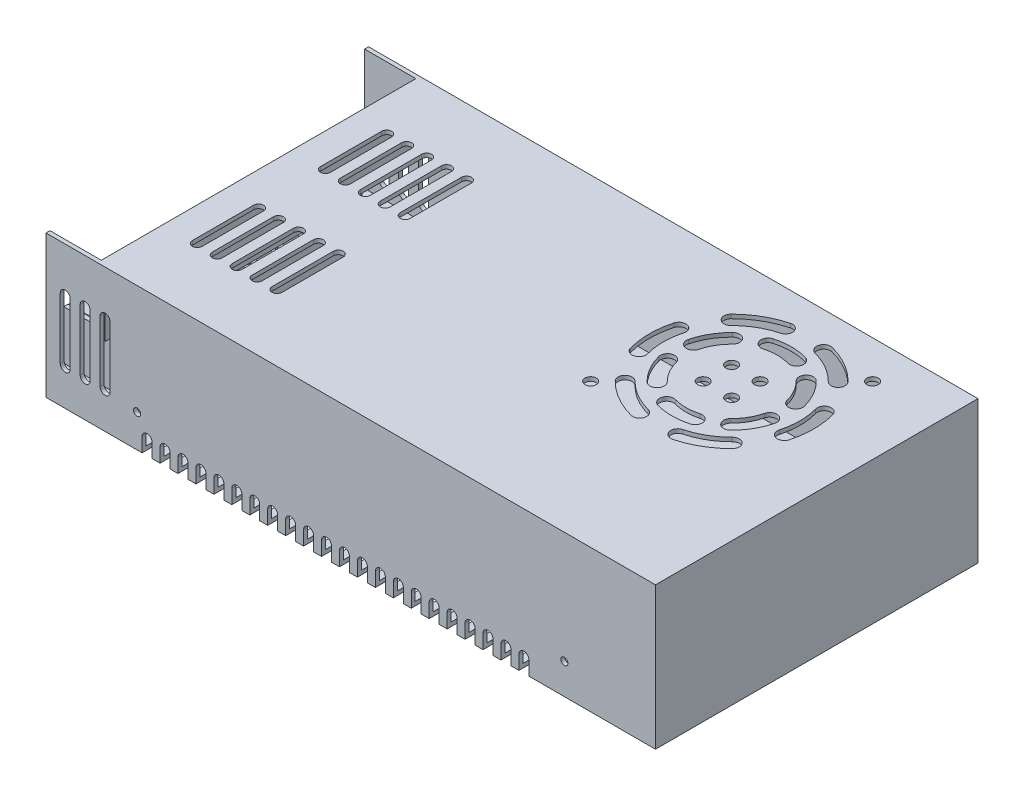
from build123d import *

# Parameters (mm, degrees)
BOSS_EXTRUDE1_DEPTH                  = 50
SKETCH2_W                            = 214
SKETCH2_H                            = 113.25
BOSS_EXTRUDE2_DEPTH                  = 1.4
SKETCH3_W                            = 196
SKETCH3_H                            = 113.25
BOSS_EXTRUDE3_DEPTH                  = 1.4
SKETCH4_W                            = 1.4
SKETCH4_H                            = 110.45
BOSS_EXTRUDE4_DEPTH                  = 24
SKETCH16_W                           = 1.4
SKETCH16_H                           = 110.45
BOSS_EXTRUDE5_DEPTH                  = 6
CUT_EXTRUDE1_DEPTH                   = 1.4
CUT_EXTRUDE2_DEPTH                   = 1.4
CUT_EXTRUDE3_START                   = -1.4
CUT_EXTRUDE3_DEPTH                   = 1.4
CUT_EXTRUDE4_DEPTH                   = 1.4
SKETCH15_R                           = 2
CUT_EXTRUDE5_DEPTH                   = 1.4
SKETCH17_W                           = 212.5
SKETCH17_H                           = 110.25
BOSS_EXTRUDE6_DEPTH                  = 1.6
TAP_START                            = -56.625
TAP_DRILL_FOR_M3X0_5_TAP1_OUTLINE_R  = 1.25
TAP_DRILL_FOR_M3X0_5_TAP1_DEPTH      = 1.4
TAP_START_2                          = 55.225
TAP_DRILL_FOR_M3X0_5_TAP2_OUTLINE_R  = 1.25
TAP_DRILL_FOR_M3X0_5_TAP2_DEPTH      = 1.4
SKETCH20_W                           = 1.25
SKETCH20_H                           = 1.4
TAP_DRILL_FOR_M3X0_5_TAP3_AT_2_COUNT = 2
TAP_DRILL_FOR_M3X0_5_TAP3_AT_2_PITCH = 95
TAP_DRILL_FOR_M3X0_5_TAP3_AT_3_COUNT = 2
TAP_DRILL_FOR_M3X0_5_TAP3_AT_3_PITCH = 177
TAP_DRILL_FOR_M3X0_5_TAP3_AT_4_COUNT = 2
TAP_DRILL_FOR_M3X0_5_TAP3_AT_4_PITCH = 200.883050554
SKETCH21_W                           = 1.65
SKETCH21_H                           = 7.7
TAP_DRILL_FOR_M4X0_7_TAP1_AT_2_COUNT = 2
TAP_DRILL_FOR_M4X0_7_TAP1_AT_2_PITCH = 50
TAP_DRILL_FOR_M4X0_7_TAP1_AT_3_COUNT = 2
TAP_DRILL_FOR_M4X0_7_TAP1_AT_3_PITCH = 150
TAP_DRILL_FOR_M4X0_7_TAP1_AT_4_COUNT = 2
TAP_DRILL_FOR_M4X0_7_TAP1_AT_4_PITCH = 158.113883008
SKETCH22_W                           = 17.5
SKETCH22_H                           = 87.3
BOSS_EXTRUDE7_DEPTH                  = 7
BOSS_EXTRUDE8_DEPTH                  = 13.2
BOSS_EXTRUDE9_DEPTH                  = 17.2
SKETCH23_W                           = 7.633333334
SKETCH23_H                           = 7.633333333
SKETCH23_H_2                         = 7.633333334
BOSS_EXTRUDE10_DEPTH                 = 1.2
SKETCH23_3_R                         = 3.25
BOSS_EXTRUDE11_DEPTH                 = 4
FILLET1_R                            = 1
CUT_EXTRUDE7_START                   = 3
CUT_EXTRUDE7_DEPTH                   = 1
SKETCH24_W                           = 17.3
SKETCH24_H                           = 83.9
BOSS_EXTRUDE12_DEPTH                 = 2
SKETCH25_W                           = 1.9
SKETCH25_H                           = 0.25
SKETCH25_W_2                         = 2.7
SKETCH25_W_3                         = 0.4
SKETCH25_H_2                         = 8.5
BOSS_EXTRUDE13_DEPTH                 = 0.01


# Read off the part's stored shape, not the designer's step: Tap Drill for M3x0.5 Tap1, Tap Drill for M3x0.5 Tap2
with BuildPart() as part:
    # Sketch1 → Boss-Extrude1 (new body)
    with BuildSketch(Plane(origin=(0, 0, 0), x_dir=(1, 0, 0), z_dir=(0, 1, 0))):
        Polygon((-107, 55.225), (105.6, 55.225), (105.6, -55.225), (-107, -55.225), (-107, -56.625), (107, -56.625), (107, 56.625), (-107, 56.625), align=None)
    extrude(amount=BOSS_EXTRUDE1_DEPTH)

    # Sketch2 → Boss-Extrude2 (add)
    with BuildSketch(Plane(origin=(0, 0, 0), x_dir=(1, 0, 0), z_dir=(0, 1, 0))):
        Rectangle(SKETCH2_W, SKETCH2_H)
    extrude(amount=BOSS_EXTRUDE2_DEPTH)

    # Sketch3 → Boss-Extrude3 (add)
    with BuildSketch(Plane(origin=(0, 50, 0), x_dir=(1, 0, 0), z_dir=(0, 1, 0))):
        with Locations((9, 0)):
            Rectangle(SKETCH3_W, SKETCH3_H)
    extrude(amount=-BOSS_EXTRUDE3_DEPTH)

    # Sketch4 → Boss-Extrude4 (add)
    with BuildSketch(Plane(origin=(0, 50, 0), x_dir=(1, 0, 0), z_dir=(0, 1, 0))):
        with Locations((-88.3, 0)):
            Rectangle(SKETCH4_W, SKETCH4_H)
    extrude(amount=-BOSS_EXTRUDE4_DEPTH)

    # Sketch16 → Boss-Extrude5 (add)
    with BuildSketch(Plane.XZ):
        with Locations((-106.3, 0)):
            Rectangle(SKETCH16_W, SKETCH16_H)
    extrude(amount=-BOSS_EXTRUDE5_DEPTH)

    # Sketch5 → Cut-Extrude1 (cut)
    with BuildSketch(Plane(origin=(0, 50, 0), x_dir=(1, 0, 0), z_dir=(0, 1, 0))):
        with BuildLine():
            Line((-79, -11.75), (-79, -33.25))
            ThreePointArc((-79, -33.25), (-77.25, -35), (-75.5, -33.25))
            Line((-75.5, -33.25), (-75.5, -11.75))
            ThreePointArc((-75.5, -11.75), (-77.25, -10), (-79, -11.75))
        make_face()
        with BuildLine():
            Line((-72, -11.75), (-72, -33.25))
            ThreePointArc((-72, -33.25), (-70.25, -35), (-68.5, -33.25))
            Line((-68.5, -33.25), (-68.5, -11.75))
            ThreePointArc((-68.5, -11.75), (-70.25, -10), (-72, -11.75))
        make_face()
        with BuildLine():
            Line((-65, -11.75), (-65, -33.25))
            ThreePointArc((-65, -33.25), (-63.25, -35), (-61.5, -33.25))
            Line((-61.5, -33.25), (-61.5, -11.75))
            ThreePointArc((-61.5, -11.75), (-63.25, -10), (-65, -11.75))
        make_face()
        with BuildLine():
            Line((-58, -11.75), (-58, -33.25))
            ThreePointArc((-58, -33.25), (-56.25, -35), (-54.5, -33.25))
            Line((-54.5, -33.25), (-54.5, -11.75))
            ThreePointArc((-54.5, -11.75), (-56.25, -10), (-58, -11.75))
        make_face()
        with BuildLine():
            Line((-51, -11.75), (-51, -33.25))
            ThreePointArc((-51, -33.25), (-49.25, -35), (-47.5, -33.25))
            Line((-47.5, -33.25), (-47.5, -11.75))
            ThreePointArc((-47.5, -11.75), (-49.25, -10), (-51, -11.75))
        make_face()
        with BuildLine():
            Line((-47.5, 33.25), (-47.5, 11.75))
            ThreePointArc((-47.5, 11.75), (-49.25, 10), (-51, 11.75))
            Line((-51, 11.75), (-51, 33.25))
            ThreePointArc((-51, 33.25), (-49.25, 35), (-47.5, 33.25))
        make_face()
        with BuildLine():
            Line((-54.5, 33.25), (-54.5, 11.75))
            ThreePointArc((-54.5, 11.75), (-56.25, 10), (-58, 11.75))
            Line((-58, 11.75), (-58, 33.25))
            ThreePointArc((-58, 33.25), (-56.25, 35), (-54.5, 33.25))
        make_face()
        with BuildLine():
            Line((-61.5, 33.25), (-61.5, 11.75))
            ThreePointArc((-61.5, 11.75), (-63.25, 10), (-65, 11.75))
            Line((-65, 11.75), (-65, 33.25))
            ThreePointArc((-65, 33.25), (-63.25, 35), (-61.5, 33.25))
        make_face()
        with BuildLine():
            Line((-68.5, 33.25), (-68.5, 11.75))
            ThreePointArc((-68.5, 11.75), (-70.25, 10), (-72, 11.75))
            Line((-72, 11.75), (-72, 33.25))
            ThreePointArc((-72, 33.25), (-70.25, 35), (-68.5, 33.25))
        make_face()
        with BuildLine():
            Line((-75.5, 33.25), (-75.5, 11.75))
            ThreePointArc((-75.5, 11.75), (-77.25, 10), (-79, 11.75))
            Line((-79, 11.75), (-79, 33.25))
            ThreePointArc((-79, 33.25), (-77.25, 35), (-75.5, 33.25))
        make_face()
    extrude(amount=-CUT_EXTRUDE1_DEPTH, mode=Mode.SUBTRACT)

    # Sketch6 → Cut-Extrude2 (cut)
    with BuildSketch(Plane(origin=(0, 0, -56.625), x_dir=(-1, 0, 0), z_dir=(0, 0, -1))):
        with BuildLine():
            Line((102, 34.25), (102, 12.75))
            ThreePointArc((102, 12.75), (100.25, 11), (98.5, 12.75))
            Line((98.5, 12.75), (98.5, 34.25))
            ThreePointArc((98.5, 34.25), (100.25, 36), (102, 34.25))
        make_face()
        with BuildLine():
            Line((91.5, 34.25), (91.5, 12.75))
            ThreePointArc((91.5, 12.75), (93.25, 11), (95, 12.75))
            Line((95, 12.75), (95, 34.25))
            ThreePointArc((95, 34.25), (93.25, 36), (91.5, 34.25))
        make_face()
        with BuildLine():
            Line((84.5, 34.25), (84.5, 12.75))
            ThreePointArc((84.5, 12.75), (86.25, 11), (88, 12.75))
            Line((88, 12.75), (88, 34.25))
            ThreePointArc((88, 34.25), (86.25, 36), (84.5, 34.25))
        make_face()
        with BuildLine():
            Line((73.25, 5), (73.25, 0))
            Line((73.25, 0), (69.75, 0))
            Line((69.75, 0), (69.75, 5))
            ThreePointArc((69.75, 5), (71.5, 6.75), (73.25, 5))
        make_face()
        with BuildLine():
            Line((66.95, 5), (66.95, 0))
            Line((66.95, 0), (63.45, 0))
            Line((63.45, 0), (63.45, 5))
            ThreePointArc((63.45, 5), (65.2, 6.75), (66.95, 5))
        make_face()
        with BuildLine():
            Line((60.65, 5), (60.65, 0))
            Line((60.65, 0), (57.15, 0))
            Line((57.15, 0), (57.15, 5))
            ThreePointArc((57.15, 5), (58.9, 6.75), (60.65, 5))
        make_face()
        with BuildLine():
            Line((54.35, 5), (54.35, 0))
            Line((54.35, 0), (50.85, 0))
            Line((50.85, 0), (50.85, 5))
            ThreePointArc((50.85, 5), (52.6, 6.75), (54.35, 5))
        make_face()
        with BuildLine():
            Line((48.05, 5), (48.05, 0))
            Line((48.05, 0), (44.55, 0))
            Line((44.55, 0), (44.55, 5))
            ThreePointArc((44.55, 5), (46.3, 6.75), (48.05, 5))
        make_face()
        with BuildLine():
            Line((41.75, 5), (41.75, 0))
            Line((41.75, 0), (38.25, 0))
            Line((38.25, 0), (38.25, 5))
            ThreePointArc((38.25, 5), (40, 6.75), (41.75, 5))
        make_face()
        with BuildLine():
            Line((35.45, 5), (35.45, 0))
            Line((35.45, 0), (31.95, 0))
            Line((31.95, 0), (31.95, 5))
            ThreePointArc((31.95, 5), (33.7, 6.75), (35.45, 5))
        make_face()
        with BuildLine():
            Line((29.15, 5), (29.15, 0))
            Line((29.15, 0), (25.65, 0))
            Line((25.65, 0), (25.65, 5))
            ThreePointArc((25.65, 5), (27.4, 6.75), (29.15, 5))
        make_face()
        with BuildLine():
            Line((22.85, 5), (22.85, 0))
            Line((22.85, 0), (19.35, 0))
            Line((19.35, 0), (19.35, 5))
            ThreePointArc((19.35, 5), (21.1, 6.75), (22.85, 5))
        make_face()
        with BuildLine():
            Line((16.55, 5), (16.55, 0))
            Line((16.55, 0), (13.05, 0))
            Line((13.05, 0), (13.05, 5))
            ThreePointArc((13.05, 5), (14.8, 6.75), (16.55, 5))
        make_face()
        with BuildLine():
            Line((10.25, 5), (10.25, 0))
            Line((10.25, 0), (6.75, 0))
            Line((6.75, 0), (6.75, 5))
            ThreePointArc((6.75, 5), (8.5, 6.75), (10.25, 5))
        make_face()
        with BuildLine():
            Line((3.95, 5), (3.95, 0))
            Line((3.95, 0), (0.45, 0))
            Line((0.45, 0), (0.45, 5))
            ThreePointArc((0.45, 5), (2.2, 6.75), (3.95, 5))
        make_face()
        with BuildLine():
            Line((-2.35, 5), (-2.35, 0))
            Line((-2.35, 0), (-5.85, 0))
            Line((-5.85, 0), (-5.85, 5))
            ThreePointArc((-5.85, 5), (-4.1, 6.75), (-2.35, 5))
        make_face()
        with BuildLine():
            Line((-8.65, 5), (-8.65, 0))
            Line((-8.65, 0), (-12.15, 0))
            Line((-12.15, 0), (-12.15, 5))
            ThreePointArc((-12.15, 5), (-10.4, 6.75), (-8.65, 5))
        make_face()
        with BuildLine():
            Line((-14.95, 5), (-14.95, 0))
            Line((-14.95, 0), (-18.45, 0))
            Line((-18.45, 0), (-18.45, 5))
            ThreePointArc((-18.45, 5), (-16.7, 6.75), (-14.95, 5))
        make_face()
        with BuildLine():
            Line((-21.25, 5), (-21.25, 0))
            Line((-21.25, 0), (-24.75, 0))
            Line((-24.75, 0), (-24.75, 5))
            ThreePointArc((-24.75, 5), (-23, 6.75), (-21.25, 5))
        make_face()
        with BuildLine():
            Line((-27.55, 5), (-27.55, 0))
            Line((-27.55, 0), (-31.05, 0))
            Line((-31.05, 0), (-31.05, 5))
            ThreePointArc((-31.05, 5), (-29.3, 6.75), (-27.55, 5))
        make_face()
        with BuildLine():
            Line((-33.85, 5), (-33.85, 0))
            Line((-33.85, 0), (-37.35, 0))
            Line((-37.35, 0), (-37.35, 5))
            ThreePointArc((-37.35, 5), (-35.6, 6.75), (-33.85, 5))
        make_face()
        with BuildLine():
            Line((-40.15, 5), (-40.15, 0))
            Line((-40.15, 0), (-43.65, 0))
            Line((-43.65, 0), (-43.65, 5))
            ThreePointArc((-43.65, 5), (-41.9, 6.75), (-40.15, 5))
        make_face()
        with BuildLine():
            Line((-46.45, 5), (-46.45, 0))
            Line((-46.45, 0), (-49.95, 0))
            Line((-49.95, 0), (-49.95, 5))
            ThreePointArc((-49.95, 5), (-48.2, 6.75), (-46.45, 5))
        make_face()
        with BuildLine():
            Line((-52.75, 5), (-52.75, 0))
            Line((-52.75, 0), (-56.25, 0))
            Line((-56.25, 0), (-56.25, 5))
            ThreePointArc((-56.25, 5), (-54.5, 6.75), (-52.75, 5))
        make_face()
        with BuildLine():
            Line((-59.05, 5), (-59.05, 0))
            Line((-59.05, 0), (-62.55, 0))
            Line((-62.55, 0), (-62.55, 5))
            ThreePointArc((-62.55, 5), (-60.8, 6.75), (-59.05, 5))
        make_face()
    extrude(amount=-CUT_EXTRUDE2_DEPTH, mode=Mode.SUBTRACT)

    # Sketch7 → Cut-Extrude3 (cut)
    with BuildSketch(Plane.XY.offset(56.625).offset(CUT_EXTRUDE3_START)):
        with BuildLine():
            Line((-102, 34.25), (-102, 12.75))
            ThreePointArc((-102, 12.75), (-100.25, 11), (-98.5, 12.75))
            Line((-98.5, 12.75), (-98.5, 34.25))
            ThreePointArc((-98.5, 34.25), (-100.25, 36), (-102, 34.25))
        make_face()
        with BuildLine():
            Line((-73.25, 5), (-73.25, 0))
            Line((-73.25, 0), (-69.75, 0))
            Line((-69.75, 0), (-69.75, 5))
            ThreePointArc((-69.75, 5), (-71.5, 6.75), (-73.25, 5))
        make_face()
        with BuildLine():
            Line((-84.5, 12.75), (-84.5, 34.25))
            ThreePointArc((-84.5, 34.25), (-86.25, 36), (-88, 34.25))
            Line((-88, 34.25), (-88, 12.75))
            ThreePointArc((-88, 12.75), (-86.25, 11), (-84.5, 12.75))
        make_face()
        with BuildLine():
            Line((-91.5, 12.75), (-91.5, 34.25))
            ThreePointArc((-91.5, 34.25), (-93.25, 36), (-95, 34.25))
            Line((-95, 34.25), (-95, 12.75))
            ThreePointArc((-95, 12.75), (-93.25, 11), (-91.5, 12.75))
        make_face()
        with BuildLine():
            Line((-54.35, 5), (-54.35, 0))
            Line((-54.35, 0), (-50.85, 0))
            Line((-50.85, 0), (-50.85, 5))
            ThreePointArc((-50.85, 5), (-52.6, 6.75), (-54.35, 5))
        make_face()
        with BuildLine():
            Line((-60.65, 5), (-60.65, 0))
            Line((-60.65, 0), (-57.15, 0))
            Line((-57.15, 0), (-57.15, 5))
            ThreePointArc((-57.15, 5), (-58.9, 6.75), (-60.65, 5))
        make_face()
        with BuildLine():
            Line((-63.45, 0), (-63.45, 5))
            ThreePointArc((-63.45, 5), (-65.2, 6.75), (-66.95, 5))
            Line((-66.95, 5), (-66.95, 0))
            Line((-66.95, 0), (-63.45, 0))
        make_face()
        with BuildLine():
            Line((-29.15, 5), (-29.15, 0))
            Line((-29.15, 0), (-25.65, 0))
            Line((-25.65, 0), (-25.65, 5))
            ThreePointArc((-25.65, 5), (-27.4, 6.75), (-29.15, 5))
        make_face()
        with BuildLine():
            Line((-35.45, 5), (-35.45, 0))
            Line((-35.45, 0), (-31.95, 0))
            Line((-31.95, 0), (-31.95, 5))
            ThreePointArc((-31.95, 5), (-33.7, 6.75), (-35.45, 5))
        make_face()
        with BuildLine():
            Line((-41.75, 5), (-41.75, 0))
            Line((-41.75, 0), (-38.25, 0))
            Line((-38.25, 0), (-38.25, 5))
            ThreePointArc((-38.25, 5), (-40, 6.75), (-41.75, 5))
        make_face()
        with BuildLine():
            Line((-44.55, 0), (-44.55, 5))
            ThreePointArc((-44.55, 5), (-46.3, 6.75), (-48.05, 5))
            Line((-48.05, 5), (-48.05, 0))
            Line((-48.05, 0), (-44.55, 0))
        make_face()
        with BuildLine():
            Line((-10.25, 5), (-10.25, 0))
            Line((-10.25, 0), (-6.75, 0))
            Line((-6.75, 0), (-6.75, 5))
            ThreePointArc((-6.75, 5), (-8.5, 6.75), (-10.25, 5))
        make_face()
        with BuildLine():
            Line((-16.55, 5), (-16.55, 0))
            Line((-16.55, 0), (-13.05, 0))
            Line((-13.05, 0), (-13.05, 5))
            ThreePointArc((-13.05, 5), (-14.8, 6.75), (-16.55, 5))
        make_face()
        with BuildLine():
            Line((-22.85, 5), (-22.85, 0))
            Line((-22.85, 0), (-19.35, 0))
            Line((-19.35, 0), (-19.35, 5))
            ThreePointArc((-19.35, 5), (-21.1, 6.75), (-22.85, 5))
        make_face()
        with BuildLine():
            Line((8.65, 5), (8.65, 0))
            Line((8.65, 0), (12.15, 0))
            Line((12.15, 0), (12.15, 5))
            ThreePointArc((12.15, 5), (10.4, 6.75), (8.65, 5))
        make_face()
        with BuildLine():
            Line((2.35, 5), (2.35, 0))
            Line((2.35, 0), (5.85, 0))
            Line((5.85, 0), (5.85, 5))
            ThreePointArc((5.85, 5), (4.1, 6.75), (2.35, 5))
        make_face()
        with BuildLine():
            Line((-3.95, 5), (-3.95, 0))
            Line((-3.95, 0), (-0.45, 0))
            Line((-0.45, 0), (-0.45, 5))
            ThreePointArc((-0.45, 5), (-2.2, 6.75), (-3.95, 5))
        make_face()
        with BuildLine():
            Line((27.55, 5), (27.55, 0))
            Line((27.55, 0), (31.05, 0))
            Line((31.05, 0), (31.05, 5))
            ThreePointArc((31.05, 5), (29.3, 6.75), (27.55, 5))
        make_face()
        with BuildLine():
            Line((21.25, 5), (21.25, 0))
            Line((21.25, 0), (24.75, 0))
            Line((24.75, 0), (24.75, 5))
            ThreePointArc((24.75, 5), (23, 6.75), (21.25, 5))
        make_face()
        with BuildLine():
            Line((14.95, 5), (14.95, 0))
            Line((14.95, 0), (18.45, 0))
            Line((18.45, 0), (18.45, 5))
            ThreePointArc((18.45, 5), (16.7, 6.75), (14.95, 5))
        make_face()
        with BuildLine():
            Line((46.45, 5), (46.45, 0))
            Line((46.45, 0), (49.95, 0))
            Line((49.95, 0), (49.95, 5))
            ThreePointArc((49.95, 5), (48.2, 6.75), (46.45, 5))
        make_face()
        with BuildLine():
            Line((40.15, 5), (40.15, 0))
            Line((40.15, 0), (43.65, 0))
            Line((43.65, 0), (43.65, 5))
            ThreePointArc((43.65, 5), (41.9, 6.75), (40.15, 5))
        make_face()
        with BuildLine():
            Line((37.35, 0), (37.35, 5))
            ThreePointArc((37.35, 5), (35.6, 6.75), (33.85, 5))
            Line((33.85, 5), (33.85, 0))
            Line((33.85, 0), (37.35, 0))
        make_face()
        with BuildLine():
            Line((59.05, 5), (59.05, 0))
            Line((59.05, 0), (62.55, 0))
            Line((62.55, 0), (62.55, 5))
            ThreePointArc((62.55, 5), (60.8, 6.75), (59.05, 5))
        make_face()
        with BuildLine():
            Line((56.25, 0), (56.25, 5))
            ThreePointArc((56.25, 5), (54.5, 6.75), (52.75, 5))
            Line((52.75, 5), (52.75, 0))
            Line((52.75, 0), (56.25, 0))
        make_face()
    extrude(amount=CUT_EXTRUDE3_DEPTH, mode=Mode.SUBTRACT)

    # Sketch14 → Cut-Extrude4 (cut)
    with BuildSketch(Plane.XZ):
        with BuildLine():
            Line((-73.25, -55.225), (-73.25, -36.975))
            ThreePointArc((-73.25, -36.975), (-71.5, -35.225), (-69.75, -36.975))
            Line((-69.75, -36.975), (-69.75, -55.225))
            Line((-69.75, -55.225), (-73.25, -55.225))
        make_face()
        with BuildLine():
            Line((-66.95, -55.225), (-66.95, -36.975))
            ThreePointArc((-66.95, -36.975), (-65.2, -35.225), (-63.45, -36.975))
            Line((-63.45, -36.975), (-63.45, -55.225))
            Line((-63.45, -55.225), (-66.95, -55.225))
        make_face()
        with BuildLine():
            Line((-60.65, -55.225), (-60.65, -36.975))
            ThreePointArc((-60.65, -36.975), (-58.9, -35.225), (-57.15, -36.975))
            Line((-57.15, -36.975), (-57.15, -55.225))
            Line((-57.15, -55.225), (-60.65, -55.225))
        make_face()
        with BuildLine():
            Line((-54.35, -55.225), (-54.35, -36.975))
            ThreePointArc((-54.35, -36.975), (-52.6, -35.225), (-50.85, -36.975))
            Line((-50.85, -36.975), (-50.85, -55.225))
            Line((-50.85, -55.225), (-54.35, -55.225))
        make_face()
        with BuildLine():
            Line((-48.05, -55.225), (-48.05, -36.975))
            ThreePointArc((-48.05, -36.975), (-46.3, -35.225), (-44.55, -36.975))
            Line((-44.55, -36.975), (-44.55, -55.225))
            Line((-44.55, -55.225), (-48.05, -55.225))
        make_face()
        with BuildLine():
            Line((-41.75, -55.225), (-41.75, -36.975))
            ThreePointArc((-41.75, -36.975), (-40, -35.225), (-38.25, -36.975))
            Line((-38.25, -36.975), (-38.25, -55.225))
            Line((-38.25, -55.225), (-41.75, -55.225))
        make_face()
        with BuildLine():
            Line((-35.45, -55.225), (-35.45, -36.975))
            ThreePointArc((-35.45, -36.975), (-33.7, -35.225), (-31.95, -36.975))
            Line((-31.95, -36.975), (-31.95, -55.225))
            Line((-31.95, -55.225), (-35.45, -55.225))
        make_face()
        with BuildLine():
            Line((-29.15, -55.225), (-29.15, -36.975))
            ThreePointArc((-29.15, -36.975), (-27.4, -35.225), (-25.65, -36.975))
            Line((-25.65, -36.975), (-25.65, -55.225))
            Line((-25.65, -55.225), (-29.15, -55.225))
        make_face()
        with BuildLine():
            Line((-22.85, -55.225), (-22.85, -36.975))
            ThreePointArc((-22.85, -36.975), (-21.1, -35.225), (-19.35, -36.975))
            Line((-19.35, -36.975), (-19.35, -55.225))
            Line((-19.35, -55.225), (-22.85, -55.225))
        make_face()
        with BuildLine():
            Line((-16.55, -55.225), (-16.55, -36.975))
            ThreePointArc((-16.55, -36.975), (-14.8, -35.225), (-13.05, -36.975))
            Line((-13.05, -36.975), (-13.05, -55.225))
            Line((-13.05, -55.225), (-16.55, -55.225))
        make_face()
        with BuildLine():
            Line((-10.25, -55.225), (-10.25, -36.975))
            ThreePointArc((-10.25, -36.975), (-8.5, -35.225), (-6.75, -36.975))
            Line((-6.75, -36.975), (-6.75, -55.225))
            Line((-6.75, -55.225), (-10.25, -55.225))
        make_face()
        with BuildLine():
            Line((-3.95, -55.225), (-3.95, -36.975))
            ThreePointArc((-3.95, -36.975), (-2.2, -35.225), (-0.45, -36.975))
            Line((-0.45, -36.975), (-0.45, -55.225))
            Line((-0.45, -55.225), (-3.95, -55.225))
        make_face()
        with BuildLine():
            Line((2.35, -55.225), (2.35, -36.975))
            ThreePointArc((2.35, -36.975), (4.1, -35.225), (5.85, -36.975))
            Line((5.85, -36.975), (5.85, -55.225))
            Line((5.85, -55.225), (2.35, -55.225))
        make_face()
        with BuildLine():
            Line((8.65, -55.225), (8.65, -36.975))
            ThreePointArc((8.65, -36.975), (10.4, -35.225), (12.15, -36.975))
            Line((12.15, -36.975), (12.15, -55.225))
            Line((12.15, -55.225), (8.65, -55.225))
        make_face()
        with BuildLine():
            Line((14.95, -55.225), (14.95, -36.975))
            ThreePointArc((14.95, -36.975), (16.7, -35.225), (18.45, -36.975))
            Line((18.45, -36.975), (18.45, -55.225))
            Line((18.45, -55.225), (14.95, -55.225))
        make_face()
        with BuildLine():
            Line((21.25, -55.225), (21.25, -36.975))
            ThreePointArc((21.25, -36.975), (23, -35.225), (24.75, -36.975))
            Line((24.75, -36.975), (24.75, -55.225))
            Line((24.75, -55.225), (21.25, -55.225))
        make_face()
        with BuildLine():
            Line((27.55, -55.225), (27.55, -36.975))
            ThreePointArc((27.55, -36.975), (29.3, -35.225), (31.05, -36.975))
            Line((31.05, -36.975), (31.05, -55.225))
            Line((31.05, -55.225), (27.55, -55.225))
        make_face()
        with BuildLine():
            Line((33.85, -55.225), (33.85, -36.975))
            ThreePointArc((33.85, -36.975), (35.6, -35.225), (37.35, -36.975))
            Line((37.35, -36.975), (37.35, -55.225))
            Line((37.35, -55.225), (33.85, -55.225))
        make_face()
        with BuildLine():
            Line((40.15, -55.225), (40.15, -36.975))
            ThreePointArc((40.15, -36.975), (41.9, -35.225), (43.65, -36.975))
            Line((43.65, -36.975), (43.65, -55.225))
            Line((43.65, -55.225), (40.15, -55.225))
        make_face()
        with BuildLine():
            Line((46.45, -55.225), (46.45, -36.975))
            ThreePointArc((46.45, -36.975), (48.2, -35.225), (49.95, -36.975))
            Line((49.95, -36.975), (49.95, -55.225))
            Line((49.95, -55.225), (46.45, -55.225))
        make_face()
        with BuildLine():
            Line((52.75, -55.225), (52.75, -36.975))
            ThreePointArc((52.75, -36.975), (54.5, -35.225), (56.25, -36.975))
            Line((56.25, -36.975), (56.25, -55.225))
            Line((56.25, -55.225), (52.75, -55.225))
        make_face()
        with BuildLine():
            Line((59.05, -55.225), (59.05, -36.975))
            ThreePointArc((59.05, -36.975), (60.8, -35.225), (62.55, -36.975))
            Line((62.55, -36.975), (62.55, -55.225))
            Line((62.55, -55.225), (59.05, -55.225))
        make_face()
        with BuildLine():
            Line((59.05, 55.225), (62.55, 55.225))
            Line((62.55, 55.225), (62.55, 36.975))
            ThreePointArc((62.55, 36.975), (60.8, 35.225), (59.05, 36.975))
            Line((59.05, 36.975), (59.05, 55.225))
        make_face()
        with BuildLine():
            Line((52.75, 55.225), (56.25, 55.225))
            Line((56.25, 55.225), (56.25, 36.975))
            ThreePointArc((56.25, 36.975), (54.5, 35.225), (52.75, 36.975))
            Line((52.75, 36.975), (52.75, 55.225))
        make_face()
        with BuildLine():
            Line((46.45, 55.225), (49.95, 55.225))
            Line((49.95, 55.225), (49.95, 36.975))
            ThreePointArc((49.95, 36.975), (48.2, 35.225), (46.45, 36.975))
            Line((46.45, 36.975), (46.45, 55.225))
        make_face()
        with BuildLine():
            Line((40.15, 55.225), (43.65, 55.225))
            Line((43.65, 55.225), (43.65, 36.975))
            ThreePointArc((43.65, 36.975), (41.9, 35.225), (40.15, 36.975))
            Line((40.15, 36.975), (40.15, 55.225))
        make_face()
        with BuildLine():
            Line((33.85, 55.225), (37.35, 55.225))
            Line((37.35, 55.225), (37.35, 36.975))
            ThreePointArc((37.35, 36.975), (35.6, 35.225), (33.85, 36.975))
            Line((33.85, 36.975), (33.85, 55.225))
        make_face()
        with BuildLine():
            Line((27.55, 55.225), (31.05, 55.225))
            Line((31.05, 55.225), (31.05, 36.975))
            ThreePointArc((31.05, 36.975), (29.3, 35.225), (27.55, 36.975))
            Line((27.55, 36.975), (27.55, 55.225))
        make_face()
        with BuildLine():
            Line((21.25, 55.225), (24.75, 55.225))
            Line((24.75, 55.225), (24.75, 36.975))
            ThreePointArc((24.75, 36.975), (23, 35.225), (21.25, 36.975))
            Line((21.25, 36.975), (21.25, 55.225))
        make_face()
        with BuildLine():
            Line((14.95, 55.225), (18.45, 55.225))
            Line((18.45, 55.225), (18.45, 36.975))
            ThreePointArc((18.45, 36.975), (16.7, 35.225), (14.95, 36.975))
            Line((14.95, 36.975), (14.95, 55.225))
        make_face()
        with BuildLine():
            Line((8.65, 55.225), (12.15, 55.225))
            Line((12.15, 55.225), (12.15, 36.975))
            ThreePointArc((12.15, 36.975), (10.4, 35.225), (8.65, 36.975))
            Line((8.65, 36.975), (8.65, 55.225))
        make_face()
        with BuildLine():
            Line((2.35, 55.225), (5.85, 55.225))
            Line((5.85, 55.225), (5.85, 36.975))
            ThreePointArc((5.85, 36.975), (4.1, 35.225), (2.35, 36.975))
            Line((2.35, 36.975), (2.35, 55.225))
        make_face()
        with BuildLine():
            Line((-3.95, 55.225), (-0.45, 55.225))
            Line((-0.45, 55.225), (-0.45, 36.975))
            ThreePointArc((-0.45, 36.975), (-2.2, 35.225), (-3.95, 36.975))
            Line((-3.95, 36.975), (-3.95, 55.225))
        make_face()
        with BuildLine():
            Line((-10.25, 55.225), (-6.75, 55.225))
            Line((-6.75, 55.225), (-6.75, 36.975))
            ThreePointArc((-6.75, 36.975), (-8.5, 35.225), (-10.25, 36.975))
            Line((-10.25, 36.975), (-10.25, 55.225))
        make_face()
        with BuildLine():
            Line((-16.55, 55.225), (-13.05, 55.225))
            Line((-13.05, 55.225), (-13.05, 36.975))
            ThreePointArc((-13.05, 36.975), (-14.8, 35.225), (-16.55, 36.975))
            Line((-16.55, 36.975), (-16.55, 55.225))
        make_face()
        with BuildLine():
            Line((-22.85, 55.225), (-19.35, 55.225))
            Line((-19.35, 55.225), (-19.35, 36.975))
            ThreePointArc((-19.35, 36.975), (-21.1, 35.225), (-22.85, 36.975))
            Line((-22.85, 36.975), (-22.85, 55.225))
        make_face()
        with BuildLine():
            Line((-29.15, 55.225), (-25.65, 55.225))
            Line((-25.65, 55.225), (-25.65, 36.975))
            ThreePointArc((-25.65, 36.975), (-27.4, 35.225), (-29.15, 36.975))
            Line((-29.15, 36.975), (-29.15, 55.225))
        make_face()
        with BuildLine():
            Line((-35.45, 55.225), (-31.95, 55.225))
            Line((-31.95, 55.225), (-31.95, 36.975))
            ThreePointArc((-31.95, 36.975), (-33.7, 35.225), (-35.45, 36.975))
            Line((-35.45, 36.975), (-35.45, 55.225))
        make_face()
        with BuildLine():
            Line((-41.75, 55.225), (-38.25, 55.225))
            Line((-38.25, 55.225), (-38.25, 36.975))
            ThreePointArc((-38.25, 36.975), (-40, 35.225), (-41.75, 36.975))
            Line((-41.75, 36.975), (-41.75, 55.225))
        make_face()
        with BuildLine():
            Line((-48.05, 55.225), (-44.55, 55.225))
            Line((-44.55, 55.225), (-44.55, 36.975))
            ThreePointArc((-44.55, 36.975), (-46.3, 35.225), (-48.05, 36.975))
            Line((-48.05, 36.975), (-48.05, 55.225))
        make_face()
        with BuildLine():
            Line((-54.35, 55.225), (-50.85, 55.225))
            Line((-50.85, 55.225), (-50.85, 36.975))
            ThreePointArc((-50.85, 36.975), (-52.6, 35.225), (-54.35, 36.975))
            Line((-54.35, 36.975), (-54.35, 55.225))
        make_face()
        with BuildLine():
            Line((-60.65, 55.225), (-57.15, 55.225))
            Line((-57.15, 55.225), (-57.15, 36.975))
            ThreePointArc((-57.15, 36.975), (-58.9, 35.225), (-60.65, 36.975))
            Line((-60.65, 36.975), (-60.65, 55.225))
        make_face()
        with BuildLine():
            Line((-66.95, 55.225), (-63.45, 55.225))
            Line((-63.45, 55.225), (-63.45, 36.975))
            ThreePointArc((-63.45, 36.975), (-65.2, 35.225), (-66.95, 36.975))
            Line((-66.95, 36.975), (-66.95, 55.225))
        make_face()
        with BuildLine():
            Line((-69.75, 36.975), (-69.75, 55.225))
            Line((-69.75, 55.225), (-73.25, 55.225))
            Line((-73.25, 55.225), (-73.25, 36.975))
            ThreePointArc((-73.25, 36.975), (-71.5, 35.225), (-69.75, 36.975))
        make_face()
    extrude(amount=-CUT_EXTRUDE4_DEPTH, mode=Mode.SUBTRACT)

    # Sketch15 → Cut-Extrude5 (cut)
    with BuildSketch(Plane(origin=(0, 50, 0), x_dir=(1, 0, 0), z_dir=(0, 1, 0))):
        with Locations(Location((63.5, 13.625, 0), (0, 0, 270))):
            Circle(SKETCH15_R)
        with Locations(Location((53.5, 13.625, 0), (0, 0, 270))):
            Circle(SKETCH15_R)
        with Locations(Location((53.5, 23.625, 0), (0, 0, 270))):
            Circle(SKETCH15_R)
        with Locations(Location((63.5, 23.625, 0), (0, 0, 270))):
            Circle(SKETCH15_R)
        with Locations(Location((83.248737342, 43.373737342, 0), (0, 0, 270))):
            Circle(SKETCH15_R)
        with Locations(Location((33.751262658, -6.123737342, 0), (0, 0, 270))):
            Circle(SKETCH15_R)
        with BuildLine():
            ThreePointArc((86.384615135, 10.974806293), (87.415, 18.625), (86.384615135, 26.275193707))
            ThreePointArc((86.384615135, 26.275193707), (83.364494342, 27.994927086), (81.644760963, 24.974806293))
            ThreePointArc((81.644760963, 24.974806293), (82.5, 18.625), (81.644760963, 12.275193707))
            ThreePointArc((81.644760963, 12.275193707), (83.364494342, 9.255072914), (86.384615135, 10.974806293))
        make_face()
        with BuildLine():
            ThreePointArc((64.175675676, 38.843474364), (58.5, 39.625), (52.824324324, 38.843474364))
            ThreePointArc((52.824324324, 38.843474364), (51.093038766, 35.760837455), (54.175675676, 34.029551897))
            ThreePointArc((54.175675676, 34.029551897), (58.5, 34.625), (62.824324324, 34.029551897))
            ThreePointArc((62.824324324, 34.029551897), (65.906961234, 35.760837455), (64.175675676, 38.843474364))
        make_face()
        with BuildLine():
            ThreePointArc((64.573286923, -4.593854105), (62.817652283, -7.593247296), (65.817045474, -9.348881935))
            ThreePointArc((65.817045474, -9.348881935), (72.9575, -6.41612455), (79.067569662, -1.698688229))
            ThreePointArc((79.067569662, -1.698688229), (79.046842059, 1.77667979), (75.571474041, 1.755952188))
            ThreePointArc((75.571474041, 1.755952188), (70.5, -2.159609691), (64.573286923, -4.593854105))
        make_face()
        with BuildLine():
            ThreePointArc((41.428525959, 1.755952188), (37.953157941, 1.77667979), (37.932430338, -1.698688229))
            ThreePointArc((37.932430338, -1.698688229), (44.0425, -6.41612455), (51.182954526, -9.348881935))
            ThreePointArc((51.182954526, -9.348881935), (54.182347717, -7.593247296), (52.426713077, -4.593854105))
            ThreePointArc((52.426713077, -4.593854105), (46.5, -2.159609691), (41.428525959, 1.755952188))
        make_face()
        with BuildLine():
            ThreePointArc((35.355239037, 24.974806293), (33.635505658, 27.994927086), (30.615384865, 26.275193707))
            ThreePointArc((30.615384865, 26.275193707), (29.585, 18.625), (30.615384865, 10.974806293))
            ThreePointArc((30.615384865, 10.974806293), (33.635505658, 9.255072914), (35.355239037, 12.275193707))
            ThreePointArc((35.355239037, 12.275193707), (34.5, 18.625), (35.355239037, 24.974806293))
        make_face()
        with BuildLine():
            ThreePointArc((52.426713077, 41.843854105), (54.182347717, 44.843247296), (51.182954526, 46.598881935))
            ThreePointArc((51.182954526, 46.598881935), (44.0425, 43.66612455), (37.932430338, 38.948688229))
            ThreePointArc((37.932430338, 38.948688229), (37.953157941, 35.47332021), (41.428525959, 35.494047812))
            ThreePointArc((41.428525959, 35.494047812), (46.5, 39.409609691), (52.426713077, 41.843854105))
        make_face()
        with BuildLine():
            ThreePointArc((75.571474041, 35.494047812), (79.046842059, 35.47332021), (79.067569662, 38.948688229))
            ThreePointArc((79.067569662, 38.948688229), (72.9575, 43.66612455), (65.817045474, 46.598881935))
            ThreePointArc((65.817045474, 46.598881935), (62.817652283, 44.843247296), (64.573286923, 41.843854105))
            ThreePointArc((64.573286923, 41.843854105), (70.5, 39.409609691), (75.571474041, 35.494047812))
        make_face()
        with BuildLine():
            ThreePointArc((69.678571114, 30.072250667), (69.636589934, 33.607535321), (73.171874588, 33.649516501))
            ThreePointArc((73.171874588, 33.649516501), (76.686533479, 29.125), (78.847550263, 23.818957863))
            ThreePointArc((78.847550263, 23.818957863), (77.043551168, 20.778302134), (74.002895439, 22.582301229))
            ThreePointArc((74.002895439, 22.582301229), (72.356406461, 26.625), (69.678571114, 30.072250667))
        make_face()
        with BuildLine():
            ThreePointArc((74.002895439, 14.667698771), (77.043551168, 16.471697866), (78.847550263, 13.431042137))
            ThreePointArc((78.847550263, 13.431042137), (76.686533479, 8.125), (73.171874588, 3.600483499))
            ThreePointArc((73.171874588, 3.600483499), (69.636589934, 3.642464679), (69.678571114, 7.177749333))
            ThreePointArc((69.678571114, 7.177749333), (72.356406461, 10.625), (74.002895439, 14.667698771))
        make_face()
        with BuildLine():
            ThreePointArc((62.824324324, 3.220448103), (65.906961234, 1.489162545), (64.175675676, -1.593474364))
            ThreePointArc((64.175675676, -1.593474364), (58.5, -2.375), (52.824324324, -1.593474364))
            ThreePointArc((52.824324324, -1.593474364), (51.093038766, 1.489162545), (54.175675676, 3.220448103))
            ThreePointArc((54.175675676, 3.220448103), (58.5, 2.625), (62.824324324, 3.220448103))
        make_face()
        with BuildLine():
            ThreePointArc((47.321428886, 7.177749333), (47.363410066, 3.642464679), (43.828125412, 3.600483499))
            ThreePointArc((43.828125412, 3.600483499), (40.313466521, 8.125), (38.152449737, 13.431042137))
            ThreePointArc((38.152449737, 13.431042137), (39.956448832, 16.471697866), (42.997104561, 14.667698771))
            ThreePointArc((42.997104561, 14.667698771), (44.643593539, 10.625), (47.321428886, 7.177749333))
        make_face()
        with BuildLine():
            ThreePointArc((42.997104561, 22.582301229), (39.956448832, 20.778302134), (38.152449737, 23.818957863))
            ThreePointArc((38.152449737, 23.818957863), (40.313466521, 29.125), (43.828125412, 33.649516501))
            ThreePointArc((43.828125412, 33.649516501), (47.363410066, 33.607535321), (47.321428886, 30.072250667))
            ThreePointArc((47.321428886, 30.072250667), (44.643593539, 26.625), (42.997104561, 22.582301229))
        make_face()
    extrude(amount=-CUT_EXTRUDE5_DEPTH, mode=Mode.SUBTRACT)

    # Tap Drill for M3x0.5 Tap1 outline → Tap Drill for M3x0.5 Tap1 (cut)
    with BuildSketch(Plane.XY.offset(TAP_START)):
        with Locations((-75, 11.5)):
            Circle(TAP_DRILL_FOR_M3X0_5_TAP1_OUTLINE_R)
        with Locations((75, 10.75)):
            Circle(TAP_DRILL_FOR_M3X0_5_TAP1_OUTLINE_R)
    extrude(amount=TAP_DRILL_FOR_M3X0_5_TAP1_DEPTH, mode=Mode.SUBTRACT)

    # Tap Drill for M3x0.5 Tap2 outline → Tap Drill for M3x0.5 Tap2 (cut)
    with BuildSketch(Plane.XY.offset(TAP_START_2)):
        with Locations((-75, 11.5)):
            Circle(TAP_DRILL_FOR_M3X0_5_TAP2_OUTLINE_R)
        with Locations((75, 10.75)):
            Circle(TAP_DRILL_FOR_M3X0_5_TAP2_OUTLINE_R)
    extrude(amount=TAP_DRILL_FOR_M3X0_5_TAP2_DEPTH, mode=Mode.SUBTRACT)

    # Sketch20 → Tap Drill for M3x0.5 Tap3 (revolve, cut)
    with BuildSketch(Plane(origin=(97, 0, 47.5), x_dir=(0, 0, -1), z_dir=(1, 0, 0))):
        with Locations((0.625, 0.7)):
            Rectangle(SKETCH20_W, SKETCH20_H)
    tap_drill_for_m3x0_5_tap3 = revolve(axis=Axis((97, -6.35, 47.5), (0, 1, 0)), mode=Mode.SUBTRACT)

    # Tap Drill for M3x0.5 Tap3 at 2: Tap Drill for M3x0.5 Tap3 ×2
    with Locations(*[(0, 0, -i * TAP_DRILL_FOR_M3X0_5_TAP3_AT_2_PITCH) for i in range(1, TAP_DRILL_FOR_M3X0_5_TAP3_AT_2_COUNT)]):
        add(tap_drill_for_m3x0_5_tap3, mode=Mode.SUBTRACT)

    # Tap Drill for M3x0.5 Tap3 at 3: Tap Drill for M3x0.5 Tap3 ×2
    with Locations(*[(-i * TAP_DRILL_FOR_M3X0_5_TAP3_AT_3_PITCH, 0, 0) for i in range(1, TAP_DRILL_FOR_M3X0_5_TAP3_AT_3_COUNT)]):
        add(tap_drill_for_m3x0_5_tap3, mode=Mode.SUBTRACT)

    # Tap Drill for M3x0.5 Tap3 at 4: Tap Drill for M3x0.5 Tap3 ×2
    with Locations(*[Vector(-0.8811096780520014, 0, -0.47291197409570696) * (i * TAP_DRILL_FOR_M3X0_5_TAP3_AT_4_PITCH) for i in range(1, TAP_DRILL_FOR_M3X0_5_TAP3_AT_4_COUNT)]):
        add(tap_drill_for_m3x0_5_tap3, mode=Mode.SUBTRACT)

    # Sketch21 → Tap Drill for M4x0.7 Tap1 (revolve, cut)
    with BuildSketch(Plane(origin=(75, 0, 25), x_dir=(0, 0, -1), z_dir=(1, 0, 0))):
        with Locations((0.825, 3.85)):
            Rectangle(SKETCH21_W, SKETCH21_H)
    tap_drill_for_m4x0_7_tap1 = revolve(axis=Axis((75, -6.35, 25), (0, 1, 0)), mode=Mode.SUBTRACT)

    # Tap Drill for M4x0.7 Tap1 at 2: Tap Drill for M4x0.7 Tap1 ×2
    with Locations(*[(0, 0, -i * TAP_DRILL_FOR_M4X0_7_TAP1_AT_2_PITCH) for i in range(1, TAP_DRILL_FOR_M4X0_7_TAP1_AT_2_COUNT)]):
        add(tap_drill_for_m4x0_7_tap1, mode=Mode.SUBTRACT)

    # Tap Drill for M4x0.7 Tap1 at 3: Tap Drill for M4x0.7 Tap1 ×2
    with Locations(*[(-i * TAP_DRILL_FOR_M4X0_7_TAP1_AT_3_PITCH, 0, 0) for i in range(1, TAP_DRILL_FOR_M4X0_7_TAP1_AT_3_COUNT)]):
        add(tap_drill_for_m4x0_7_tap1, mode=Mode.SUBTRACT)

    # Tap Drill for M4x0.7 Tap1 at 4: Tap Drill for M4x0.7 Tap1 ×2
    with Locations(*[Vector(-0.9486832980505139, 0, -0.31622776601683794) * (i * TAP_DRILL_FOR_M4X0_7_TAP1_AT_4_PITCH) for i in range(1, TAP_DRILL_FOR_M4X0_7_TAP1_AT_4_COUNT)]):
        add(tap_drill_for_m4x0_7_tap1, mode=Mode.SUBTRACT)

    # Sketch25 → Boss-Extrude13 (add)
    with BuildSketch(Plane.ZY.offset(89)):
        Polygon((44.283333333, 40), (44.283333333, 35.1), (46.933333333, 35.1), (46.933333333, 34.5), (43.683333333, 34.5), (43.683333333, 40), align=None)
        Polygon((34.15, 34.5), (34.15, 40), (34.75, 40), (36.8, 35.853759357), (36.8, 40), (37.4, 40), (37.4, 34.5), (36.8, 34.5), (34.75, 38.646240643), (34.75, 34.5), align=None)
        with Locations((26.241666667, 35.75)):
            Rectangle(SKETCH25_W, SKETCH25_H)
        with Locations((26.241666667, 37)):
            Rectangle(SKETCH25_W_2, SKETCH25_H)
        Polygon((24.491666667, 38.125), (27.991666667, 38.125), (27.991666667, 38.375), (26.366666667, 38.375), (26.366666667, 38.875), (26.116666667, 38.875), (26.116666667, 38.375), (24.491666667, 38.375), align=None)
        with Locations((31.008333333, 37.25)):
            Rectangle(SKETCH25_W_3, SKETCH25_H_2)
        with Locations((40.541666667, 37.25)):
            Rectangle(SKETCH25_W_3, SKETCH25_H_2)
        with Locations((21.475, 37.25)):
            Rectangle(SKETCH25_W_3, SKETCH25_H_2)
        with Locations((-7.125, 37.25)):
            Rectangle(SKETCH25_W_3, SKETCH25_H_2)
    extrude(amount=BOSS_EXTRUDE13_DEPTH)


with BuildPart() as body_2:
    # Sketch17 → Boss-Extrude6 (new body)
    with BuildSketch(Plane(origin=(0, 6.1, 0), x_dir=(1, 0, 0), z_dir=(0, 1, 0))):
        with Locations((-0.75, 0)):
            Rectangle(SKETCH17_W, SKETCH17_H)
    extrude(amount=BOSS_EXTRUDE6_DEPTH)

    # Sketch22 → Boss-Extrude7 (add)
    with BuildSketch(Plane(origin=(0, 7.7, 0), x_dir=(1, 0, 0), z_dir=(0, 1, 0))):
        with Locations((-97.85, -7.175)):
            Rectangle(SKETCH22_W, SKETCH22_H)
    extrude(amount=BOSS_EXTRUDE7_DEPTH)

    # Sketch22<3> → Boss-Extrude8 (add)
    with BuildSketch(Plane(origin=(0, 7.7, 0), x_dir=(1, 0, 0), z_dir=(0, 1, 0))):
        Polygon((-89.1, -49.325), (-89.1, 34.975), (-90.6, 34.975), (-90.6, 26.941666667), (-106.6, 26.941666667), (-106.6, 25.441666667), (-90.6, 25.441666667), (-90.6, 17.408333333), (-106.6, 17.408333333), (-106.6, 15.908333333), (-90.6, 15.908333333), (-90.6, 7.875), (-106.6, 7.875), (-106.6, 6.375), (-90.6, 6.375), (-90.6, -1.658333333), (-106.6, -1.658333333), (-106.6, -3.158333333), (-90.6, -3.158333333), (-90.6, -11.191666667), (-106.6, -11.191666667), (-106.6, -12.691666667), (-90.6, -12.691666667), (-90.6, -20.725), (-106.6, -20.725), (-106.6, -22.225), (-90.6, -22.225), (-90.6, -30.258333333), (-106.6, -30.258333333), (-106.6, -31.758333333), (-90.6, -31.758333333), (-90.6, -39.791666667), (-106.6, -39.791666667), (-106.6, -41.291666667), (-90.6, -41.291666667), (-90.6, -49.325), align=None)
    extrude(amount=BOSS_EXTRUDE8_DEPTH)

    # Sketch22<4> → Boss-Extrude9 (add)
    with BuildSketch(Plane(origin=(0, 7.7, 0), x_dir=(1, 0, 0), z_dir=(0, 1, 0))):
        Polygon((-89.1, 36.475), (-106.6, 36.475), (-106.6, 34.975), (-90.6, 34.975), (-89.1, 34.975), align=None)
        Polygon((-89.1, -50.825), (-89.1, -49.325), (-90.6, -49.325), (-106.6, -49.325), (-106.6, -50.825), align=None)
    extrude(amount=BOSS_EXTRUDE9_DEPTH)

    # Sketch23 → Boss-Extrude10 (add)
    with BuildSketch(Plane(origin=(0, 14.7, 0), x_dir=(1, 0, 0), z_dir=(0, 1, 0))):
        with Locations((-98.6, 30.958333334)):
            Rectangle(SKETCH23_W, SKETCH23_H)
        with Locations((-98.6, 21.425)):
            Rectangle(SKETCH23_W, SKETCH23_H_2)
        with Locations((-98.6, 11.891666667)):
            Rectangle(SKETCH23_W, SKETCH23_H)
        with Locations((-98.6, 2.358333334)):
            Rectangle(SKETCH23_W, SKETCH23_H)
        with Locations((-98.6, -7.175)):
            Rectangle(SKETCH23_W, SKETCH23_H_2)
        with Locations((-98.6, -16.708333334)):
            Rectangle(SKETCH23_W, SKETCH23_H)
        with Locations((-98.6, -26.241666667)):
            Rectangle(SKETCH23_W, SKETCH23_H)
        with Locations((-98.6, -35.775)):
            Rectangle(SKETCH23_W, SKETCH23_H_2)
        with Locations((-98.6, -45.308333334)):
            Rectangle(SKETCH23_W, SKETCH23_H)
    extrude(amount=BOSS_EXTRUDE10_DEPTH)

    # Sketch23<3> → Boss-Extrude11 (add)
    with BuildSketch(Plane(origin=(0, 14.7, 0), x_dir=(1, 0, 0), z_dir=(0, 1, 0))):
        with Locations(Location((-98.6, 30.958333333, 0), (0, 0, 90))):
            Circle(SKETCH23_3_R)
        with Locations(Location((-98.6, 21.425, 0), (0, 0, 90))):
            Circle(SKETCH23_3_R)
        with Locations(Location((-98.6, 11.891666667, 0), (0, 0, 90))):
            Circle(SKETCH23_3_R)
        with Locations(Location((-98.6, 2.358333333, 0), (0, 0, 90))):
            Circle(SKETCH23_3_R)
        with Locations(Location((-98.6, -7.175, 0), (0, 0, 90))):
            Circle(SKETCH23_3_R)
        with Locations(Location((-98.6, -16.708333333, 0), (0, 0, 90))):
            Circle(SKETCH23_3_R)
        with Locations(Location((-98.6, -26.241666667, 0), (0, 0, 90))):
            Circle(SKETCH23_3_R)
        with Locations(Location((-98.6, -35.775, 0), (0, 0, 90))):
            Circle(SKETCH23_3_R)
        with Locations(Location((-98.6, -45.308333333, 0), (0, 0, 90))):
            Circle(SKETCH23_3_R)
    extrude(amount=BOSS_EXTRUDE11_DEPTH)

    # Fillet1
    fillet1_edges = [body_2.edges().sort_by_distance(p)[0] for p in [
        (-98.6, 18.7, -27.708333333),
        (-98.6, 18.7, -18.175),
        (-98.6, 18.7, -8.641666667),
        (-98.6, 18.7, 0.891666667),
        (-98.6, 18.7, 10.425),
        (-98.6, 18.7, 19.958333333),
        (-98.6, 18.7, 29.491666667),
        (-98.6, 18.7, 39.025),
        (-98.6, 18.7, 48.558333333),
    ]]
    fillet(fillet1_edges, radius=FILLET1_R)

    # Sketch23<4> → Cut-Extrude7 (cut)
    with BuildSketch(Plane(origin=(0, 14.7, 0), x_dir=(1, 0, 0), z_dir=(0, 1, 0)).offset(CUT_EXTRUDE7_START)):
        with BuildLine():
            Line((-99.1, 31.458333333), (-101.811308145, 31.458333333))
            ThreePointArc((-101.811308145, 31.458333333), (-101.85, 30.958333333), (-101.811308145, 30.458333333))
            Line((-101.811308145, 30.458333333), (-99.1, 30.458333333))
            Line((-99.1, 30.458333333), (-99.1, 27.747025189))
            ThreePointArc((-99.1, 27.747025189), (-98.6, 27.708333333), (-98.1, 27.747025189))
            Line((-98.1, 27.747025189), (-98.1, 30.458333333))
            Line((-98.1, 30.458333333), (-95.388691855, 30.458333333))
            ThreePointArc((-95.388691855, 30.458333333), (-95.359687402, 30.707585921), (-95.35, 30.958333333))
            ThreePointArc((-95.35, 30.958333333), (-95.359687402, 31.209080746), (-95.388691855, 31.458333333))
            Line((-95.388691855, 31.458333333), (-98.1, 31.458333333))
            Line((-98.1, 31.458333333), (-98.1, 34.169641478))
            ThreePointArc((-98.1, 34.169641478), (-98.6, 34.208333333), (-99.1, 34.169641478))
            Line((-99.1, 34.169641478), (-99.1, 31.458333333))
        make_face()
        with BuildLine():
            Line((-99.1, 21.925), (-101.811308145, 21.925))
            ThreePointArc((-101.811308145, 21.925), (-101.85, 21.425), (-101.811308145, 20.925))
            Line((-101.811308145, 20.925), (-99.1, 20.925))
            Line((-99.1, 20.925), (-99.1, 18.213691855))
            ThreePointArc((-99.1, 18.213691855), (-98.6, 18.175), (-98.1, 18.213691855))
            Line((-98.1, 18.213691855), (-98.1, 20.925))
            Line((-98.1, 20.925), (-95.388691855, 20.925))
            ThreePointArc((-95.388691855, 20.925), (-95.359687402, 21.174252587), (-95.35, 21.425))
            ThreePointArc((-95.35, 21.425), (-95.359687402, 21.675747413), (-95.388691855, 21.925))
            Line((-95.388691855, 21.925), (-98.1, 21.925))
            Line((-98.1, 21.925), (-98.1, 24.636308145))
            ThreePointArc((-98.1, 24.636308145), (-98.6, 24.675), (-99.1, 24.636308145))
            Line((-99.1, 24.636308145), (-99.1, 21.925))
        make_face()
        with BuildLine():
            Line((-99.1, 12.391666667), (-101.811308145, 12.391666667))
            ThreePointArc((-101.811308145, 12.391666667), (-101.85, 11.891666667), (-101.811308145, 11.391666667))
            Line((-101.811308145, 11.391666667), (-99.1, 11.391666667))
            Line((-99.1, 11.391666667), (-99.1, 8.680358522))
            ThreePointArc((-99.1, 8.680358522), (-98.6, 8.641666667), (-98.1, 8.680358522))
            Line((-98.1, 8.680358522), (-98.1, 11.391666667))
            Line((-98.1, 11.391666667), (-95.388691855, 11.391666667))
            ThreePointArc((-95.388691855, 11.391666667), (-95.359687402, 11.640919254), (-95.35, 11.891666667))
            ThreePointArc((-95.35, 11.891666667), (-95.359687402, 12.142414079), (-95.388691855, 12.391666667))
            Line((-95.388691855, 12.391666667), (-98.1, 12.391666667))
            Line((-98.1, 12.391666667), (-98.1, 15.102974811))
            ThreePointArc((-98.1, 15.102974811), (-98.6, 15.141666667), (-99.1, 15.102974811))
            Line((-99.1, 15.102974811), (-99.1, 12.391666667))
        make_face()
        with BuildLine():
            Line((-99.1, 2.858333333), (-101.811308145, 2.858333333))
            ThreePointArc((-101.811308145, 2.858333333), (-101.85, 2.358333333), (-101.811308145, 1.858333333))
            Line((-101.811308145, 1.858333333), (-99.1, 1.858333333))
            Line((-99.1, 1.858333333), (-99.1, -0.852974811))
            ThreePointArc((-99.1, -0.852974811), (-98.6, -0.891666667), (-98.1, -0.852974811))
            Line((-98.1, -0.852974811), (-98.1, 1.858333333))
            Line((-98.1, 1.858333333), (-95.388691855, 1.858333333))
            ThreePointArc((-95.388691855, 1.858333333), (-95.359687402, 2.107585921), (-95.35, 2.358333333))
            ThreePointArc((-95.35, 2.358333333), (-95.359687402, 2.609080746), (-95.388691855, 2.858333333))
            Line((-95.388691855, 2.858333333), (-98.1, 2.858333333))
            Line((-98.1, 2.858333333), (-98.1, 5.569641478))
            ThreePointArc((-98.1, 5.569641478), (-98.6, 5.608333333), (-99.1, 5.569641478))
            Line((-99.1, 5.569641478), (-99.1, 2.858333333))
        make_face()
        with BuildLine():
            Line((-99.1, -6.675), (-101.811308145, -6.675))
            ThreePointArc((-101.811308145, -6.675), (-101.85, -7.175), (-101.811308145, -7.675))
            Line((-101.811308145, -7.675), (-99.1, -7.675))
            Line((-99.1, -7.675), (-99.1, -10.386308145))
            ThreePointArc((-99.1, -10.386308145), (-98.6, -10.425), (-98.1, -10.386308145))
            Line((-98.1, -10.386308145), (-98.1, -7.675))
            Line((-98.1, -7.675), (-95.388691855, -7.675))
            ThreePointArc((-95.388691855, -7.675), (-95.359687402, -7.425747413), (-95.35, -7.175))
            ThreePointArc((-95.35, -7.175), (-95.359687402, -6.924252587), (-95.388691855, -6.675))
            Line((-95.388691855, -6.675), (-98.1, -6.675))
            Line((-98.1, -6.675), (-98.1, -3.963691855))
            ThreePointArc((-98.1, -3.963691855), (-98.6, -3.925), (-99.1, -3.963691855))
            Line((-99.1, -3.963691855), (-99.1, -6.675))
        make_face()
        with BuildLine():
            Line((-99.1, -16.208333333), (-101.811308145, -16.208333333))
            ThreePointArc((-101.811308145, -16.208333333), (-101.85, -16.708333333), (-101.811308145, -17.208333333))
            Line((-101.811308145, -17.208333333), (-99.1, -17.208333333))
            Line((-99.1, -17.208333333), (-99.1, -19.919641478))
            ThreePointArc((-99.1, -19.919641478), (-98.6, -19.958333333), (-98.1, -19.919641478))
            Line((-98.1, -19.919641478), (-98.1, -17.208333333))
            Line((-98.1, -17.208333333), (-95.388691855, -17.208333333))
            ThreePointArc((-95.388691855, -17.208333333), (-95.359687402, -16.959080746), (-95.35, -16.708333333))
            ThreePointArc((-95.35, -16.708333333), (-95.359687402, -16.457585921), (-95.388691855, -16.208333333))
            Line((-95.388691855, -16.208333333), (-98.1, -16.208333333))
            Line((-98.1, -16.208333333), (-98.1, -13.497025189))
            ThreePointArc((-98.1, -13.497025189), (-98.6, -13.458333333), (-99.1, -13.497025189))
            Line((-99.1, -13.497025189), (-99.1, -16.208333333))
        make_face()
        with BuildLine():
            Line((-99.1, -25.741666667), (-101.811308145, -25.741666667))
            ThreePointArc((-101.811308145, -25.741666667), (-101.85, -26.241666667), (-101.811308145, -26.741666667))
            Line((-101.811308145, -26.741666667), (-99.1, -26.741666667))
            Line((-99.1, -26.741666667), (-99.1, -29.452974811))
            ThreePointArc((-99.1, -29.452974811), (-98.6, -29.491666667), (-98.1, -29.452974811))
            Line((-98.1, -29.452974811), (-98.1, -26.741666667))
            Line((-98.1, -26.741666667), (-95.388691855, -26.741666667))
            ThreePointArc((-95.388691855, -26.741666667), (-95.359687402, -26.492414079), (-95.35, -26.241666667))
            ThreePointArc((-95.35, -26.241666667), (-95.359687402, -25.990919254), (-95.388691855, -25.741666667))
            Line((-95.388691855, -25.741666667), (-98.1, -25.741666667))
            Line((-98.1, -25.741666667), (-98.1, -23.030358522))
            ThreePointArc((-98.1, -23.030358522), (-98.6, -22.991666667), (-99.1, -23.030358522))
            Line((-99.1, -23.030358522), (-99.1, -25.741666667))
        make_face()
        with BuildLine():
            Line((-99.1, -35.275), (-101.811308145, -35.275))
            ThreePointArc((-101.811308145, -35.275), (-101.85, -35.775), (-101.811308145, -36.275))
            Line((-101.811308145, -36.275), (-99.1, -36.275))
            Line((-99.1, -36.275), (-99.1, -38.986308145))
            ThreePointArc((-99.1, -38.986308145), (-98.6, -39.025), (-98.1, -38.986308145))
            Line((-98.1, -38.986308145), (-98.1, -36.275))
            Line((-98.1, -36.275), (-95.388691855, -36.275))
            ThreePointArc((-95.388691855, -36.275), (-95.359687402, -36.025747413), (-95.35, -35.775))
            ThreePointArc((-95.35, -35.775), (-95.359687402, -35.524252587), (-95.388691855, -35.275))
            Line((-95.388691855, -35.275), (-98.1, -35.275))
            Line((-98.1, -35.275), (-98.1, -32.563691855))
            ThreePointArc((-98.1, -32.563691855), (-98.6, -32.525), (-99.1, -32.563691855))
            Line((-99.1, -32.563691855), (-99.1, -35.275))
        make_face()
        with BuildLine():
            Line((-99.1, -44.808333333), (-101.811308145, -44.808333333))
            ThreePointArc((-101.811308145, -44.808333333), (-101.85, -45.308333333), (-101.811308145, -45.808333333))
            Line((-101.811308145, -45.808333333), (-99.1, -45.808333333))
            Line((-99.1, -45.808333333), (-99.1, -48.519641478))
            ThreePointArc((-99.1, -48.519641478), (-98.6, -48.558333333), (-98.1, -48.519641478))
            Line((-98.1, -48.519641478), (-98.1, -45.808333333))
            Line((-98.1, -45.808333333), (-95.388691855, -45.808333333))
            ThreePointArc((-95.388691855, -45.808333333), (-95.359687402, -45.559080746), (-95.35, -45.308333333))
            ThreePointArc((-95.35, -45.308333333), (-95.359687402, -45.057585921), (-95.388691855, -44.808333333))
            Line((-95.388691855, -44.808333333), (-98.1, -44.808333333))
            Line((-98.1, -44.808333333), (-98.1, -42.097025189))
            ThreePointArc((-98.1, -42.097025189), (-98.6, -42.058333333), (-99.1, -42.097025189))
            Line((-99.1, -42.097025189), (-99.1, -44.808333333))
        make_face()
    extrude(amount=CUT_EXTRUDE7_DEPTH, mode=Mode.SUBTRACT)


with BuildPart() as body_3:
    # Sketch24 → Boss-Extrude12 (new body)
    with BuildSketch(Plane(origin=(0, 24.9, 0), x_dir=(1, 0, 0), z_dir=(0, 1, 0))):
        with Locations((-97.85, -7.175)):
            Rectangle(SKETCH24_W, SKETCH24_H)
    extrude(amount=-BOSS_EXTRUDE12_DEPTH)


solid = Compound([part.part, body_2.part, body_3.part])
